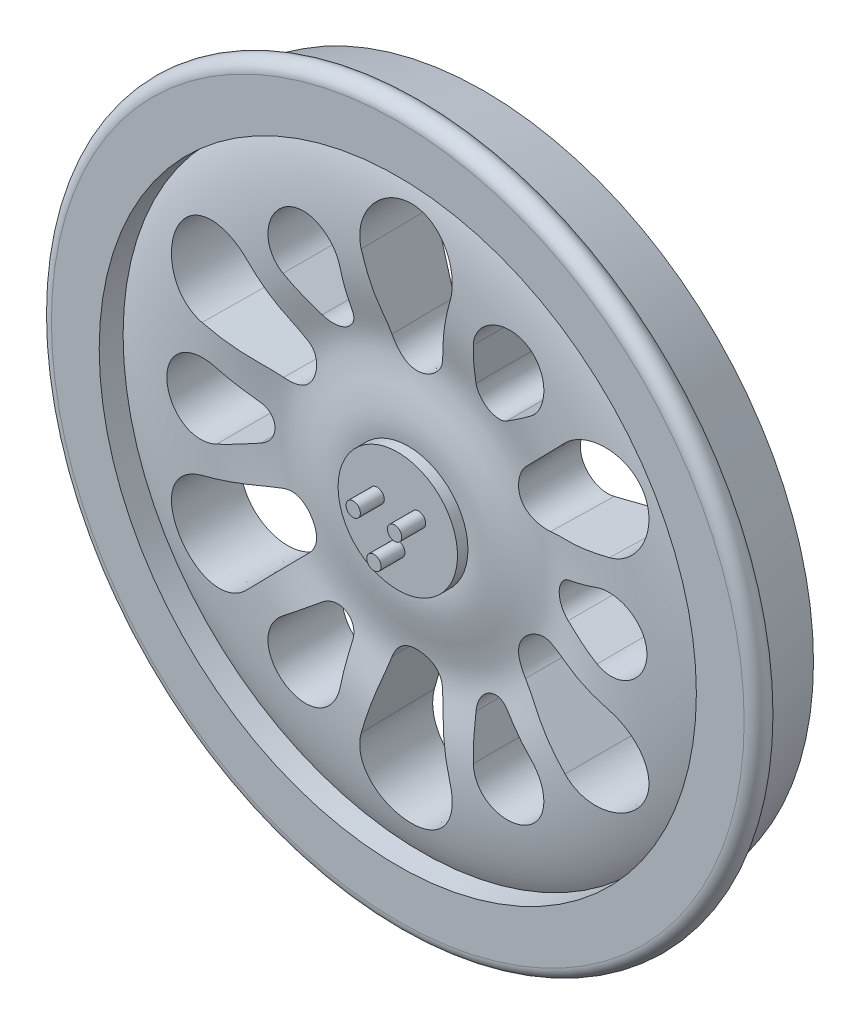
from build123d import *

# Parameters (mm, degrees)
SKETCH1_R                = 750
SKETCH1_R_2              = 625
BOSS_EXTRUDE1_DEPTH      = 50
FILLET1_R                = 25
SKETCH6_R                = 125
BOSS_EXTRUDE3_DEPTH      = 50
SKETCH8_R                = 15
BOSS_EXTRUDE4_DEPTH      = 50
CIRPATTERN1_COUNT        = 3
SKETCH9_W                = 12.905989232
SKETCH9_H                = 4
BOSS_EXTRUDE5_DEPTH      = 8
CIRPATTERN2_COUNT        = 9
SKETCH10_W               = 13.894129237
SKETCH10_H               = 6.210254734
BOSS_EXTRUDE6_DEPTH      = 10
CIRPATTERN3_COUNT        = 6
CUT_EXTRUDE1_DEPTH       = 203.423162
CUT_EXTRUDE1_DRAFT       = -1
CIRPATTERN4_COPY_1_DEPTH = 203.423162
CIRPATTERN4_COPY_1_DRAFT = -1
CIRPATTERN4_COPY_2_DEPTH = 203.423162
CIRPATTERN4_COPY_2_DRAFT = -1
CIRPATTERN4_COPY_3_DEPTH = 203.423162
CIRPATTERN4_COPY_3_DRAFT = -1
CIRPATTERN4_COPY_4_DEPTH = 203.423162
CIRPATTERN4_COPY_4_DRAFT = -1
CIRPATTERN4_COPY_5_DEPTH = 203.423162
CIRPATTERN4_COPY_5_DRAFT = -1
CUT_EXTRUDE2_REACH       = 1092.515
CIRPATTERN5_COUNT        = 6


with BuildPart() as part:
    # Sketch1 → Boss-Extrude1 (new body)
    with BuildSketch(Plane.XY):
        Circle(SKETCH1_R)
        Circle(SKETCH1_R_2, mode=Mode.SUBTRACT)
    extrude(amount=BOSS_EXTRUDE1_DEPTH)

    # Fillet1
    fillet1_edges = [part.edges().sort_by_distance(p)[0] for p in [
        (-750, 0, 0),
        (-750, 0, 50),
    ]]
    fillet(fillet1_edges, radius=FILLET1_R - 0.0001)  # a hair under: the kernel refuses the full size

    # Sketch4 → Revolve2 (revolve)
    with BuildSketch(Plane(origin=(0, 0, 0), x_dir=(0, 0, -1), z_dir=(1, 0, 0)), mode=Mode.PRIVATE) as revolve2_sk:
        Polygon((0, 0), (0, 725), (130, 690.166604984), (130, 645.166604984), (122, 645.166604984), (123.423161996, 125), (143.423161996, 125), (143.423161996, 0), align=None)
    revolve(revolve2_sk.sketch.rotate(Axis((0, 0, -143.423161996), (0, 0, 1)), 270), axis=Axis((0, 0, -143.423161996), (0, 0, 1)))

    # Sketch6 → Boss-Extrude3 (add)
    with BuildSketch(Plane.XY):
        with Locations(Location((0, 0, 0), (0, 0, 90))):
            Circle(SKETCH6_R)
    extrude(amount=BOSS_EXTRUDE3_DEPTH)

    # Sketch7 → Revolve3 (revolve)
    with BuildSketch(Plane(origin=(0, 0, 0), x_dir=(0, 0, -1), z_dir=(1, 0, 0))):
        with BuildLine():
            Line((-29.596042796, 0), (29.907052347, 0))
            Line((29.907052347, 0), (29.907052347, 625))
            Line((29.907052347, 625), (0, 625))
            add(Edge.make_bspline(
                [(0, 625), (-31.984047943, 561.665565463), (-43.874826253, 379.643970413), (10.233772598, 276.143642462), (-54.885565603, 132.651755512), (1.648232243, 44.929934245), (-29.596042796, 0)],
                knots=[0, 0, 0, 0, 0.281537496, 0.495292394, 0.717767116, 1, 1, 1, 1], degree=3))
        make_face()
    revolve(axis=Axis((0, 0, 29.596042796), (0, 0, -1)))

    # Sketch8 → Boss-Extrude4 (add)
    with BuildSketch(Plane.XY.offset(50)):
        with Locations((0, -50)):
            Circle(SKETCH8_R)
    boss_extrude4 = extrude(amount=BOSS_EXTRUDE4_DEPTH)

    # CirPattern1: Boss-Extrude4 ×3 about axis
    cirpattern1_axis = Axis((0, 0, 0), (0, 0, 1))
    for i in range(1, CIRPATTERN1_COUNT):
        add(boss_extrude4.rotate(cirpattern1_axis, i * 360 / CIRPATTERN1_COUNT))

    # Sketch9 → Boss-Extrude5 (add)
    with BuildSketch(Plane(origin=(0, 0, -143.423161996), x_dir=(-1, 0, 0), z_dir=(0, 0, -1))):
        Polygon((11.547005384, -103.966096475), (5.773502692, -93.966096475), (-5.773502692, -93.966096475), (-11.547005384, -103.966096475), (-5.773502692, -113.966096475), (5.773502692, -113.966096475), align=None)
        with Locations((0, -103.966096475)):
            Rectangle(SKETCH9_W, SKETCH9_H, mode=Mode.SUBTRACT)
    boss_extrude5 = extrude(amount=BOSS_EXTRUDE5_DEPTH)

    # CirPattern2: Boss-Extrude5 ×9 about axis
    cirpattern2_axis = Axis((0, 0, 0), (0, 0, 1))
    for i in range(1, CIRPATTERN2_COUNT):
        add(boss_extrude5.rotate(cirpattern2_axis, i * 360 / CIRPATTERN2_COUNT))

    # Sketch10 → Boss-Extrude6 (add)
    with BuildSketch(Plane(origin=(0, 0, -130), x_dir=(-1, 0, 0), z_dir=(0, 0, -1))):
        Polygon((11.547005384, -664.21212314), (5.773502692, -654.21212314), (-5.773502692, -654.21212314), (-11.547005384, -664.21212314), (-5.773502692, -674.21212314), (5.773502692, -674.21212314), align=None)
        with Locations((0.480168471, -664.46157868)):
            Rectangle(SKETCH10_W, SKETCH10_H, mode=Mode.SUBTRACT)
    boss_extrude6 = extrude(amount=BOSS_EXTRUDE6_DEPTH)

    # CirPattern3: Boss-Extrude6 ×6 about axis
    cirpattern3_axis = Axis((0, 0, 0), (0, 0, 1))
    for i in range(1, CIRPATTERN3_COUNT):
        add(boss_extrude6.rotate(cirpattern3_axis, i * 360 / CIRPATTERN3_COUNT))


with BuildPart() as cut_extrude1_tool:
    # Sketch11 → Cut-Extrude1 (with draft: the straight prism first)
    with BuildSketch(Plane(origin=(0, 0, -153.423161996), x_dir=(-1, 0, 0), z_dir=(0, 0, -1))):
        with BuildLine():
            ThreePointArc((-96.290481829, -437.773428551), (0, -564.757555535), (96.290481829, -437.773428551))
            Line((96.290481829, -437.773428551), (55.367027052, -291.741682519))
            ThreePointArc((55.367027052, -291.741682519), (0, -249.757555535), (-55.367027052, -291.741682519))
            Line((-55.367027052, -291.741682519), (-96.290481829, -437.773428551))
        make_face()
    extrude(amount=-CUT_EXTRUDE1_DEPTH)
    # Cut-Extrude1: the draft: its side faces are tilted about the plane it starts from
    cut_extrude1_sides = [cut_extrude1_tool.faces().sort_by_distance(p)[0] for p in [
        (-75.828754441, -364.757555535, -51.711580996),
        (0, -249.757555535, -51.711580996),
        (75.828754441, -364.757555535, -51.711580996),
        (0, -564.757555535, -51.711580996),
    ]]
    draft(cut_extrude1_sides, Plane(origin=(0, 0, -153.423161996), x_dir=(-1, 0, 0), z_dir=(0, 0, -1)), CUT_EXTRUDE1_DRAFT)


with BuildPart() as part_1:
    add(part.part)

    # Cut-Extrude1: cut by cut_extrude1_tool
    add(cut_extrude1_tool.part, mode=Mode.SUBTRACT)


with BuildPart() as cirpattern4_copy_1_tool:
    # CirPattern4 copy 1 sketch → CirPattern4 copy 1 (with draft: the straight prism first)
    with BuildSketch(Plane(origin=(0, 0, -153.423161996), x_dir=(-0.5000000000000001, -0.8660254037844386, 0), z_dir=(0, 0, -1))):
        with BuildLine():
            ThreePointArc((-96.290481829, -437.773428551), (0, -564.757555535), (96.290481829, -437.773428551))
            Line((96.290481829, -437.773428551), (55.367027052, -291.741682519))
            ThreePointArc((55.367027052, -291.741682519), (0, -249.757555535), (-55.367027052, -291.741682519))
            Line((-55.367027052, -291.741682519), (-96.290481829, -437.773428551))
        make_face()
    extrude(amount=-CIRPATTERN4_COPY_1_DEPTH)
    # CirPattern4 copy 1: the draft: its side faces are tilted about the plane it starts from
    cirpattern4_copy_1_sides = [cirpattern4_copy_1_tool.faces().sort_by_distance(p)[0] for p in [
        (277.974932095, -248.048405451, -51.711580996),
        (216.29638788, -124.878777767, -51.711580996),
        (353.803686536, -116.709150084, -51.711580996),
        (489.094390073, -282.378777767, -51.711580996),
    ]]
    draft(cirpattern4_copy_1_sides, Plane(origin=(0, 0, -153.423161996), x_dir=(-0.5000000000000001, -0.8660254037844386, 0), z_dir=(0, 0, -1)), CIRPATTERN4_COPY_1_DRAFT)


with BuildPart() as part_2:
    add(part_1.part)

    # CirPattern4 copy 1: cut by cirpattern4_copy_1_tool
    add(cirpattern4_copy_1_tool.part, mode=Mode.SUBTRACT)


with BuildPart() as cirpattern4_copy_2_tool:
    # CirPattern4 copy 2 sketch → CirPattern4 copy 2 (with draft: the straight prism first)
    with BuildSketch(Plane(origin=(0, 0, -153.423161996), x_dir=(0.4999999999999998, -0.8660254037844387, 0), z_dir=(0, 0, -1))):
        with BuildLine():
            ThreePointArc((-96.290481829, -437.773428551), (0, -564.757555535), (96.290481829, -437.773428551))
            Line((96.290481829, -437.773428551), (55.367027052, -291.741682519))
            ThreePointArc((55.367027052, -291.741682519), (0, -249.757555535), (-55.367027052, -291.741682519))
            Line((-55.367027052, -291.741682519), (-96.290481829, -437.773428551))
        make_face()
    extrude(amount=-CIRPATTERN4_COPY_2_DEPTH)
    # CirPattern4 copy 2: the draft: its side faces are tilted about the plane it starts from
    cirpattern4_copy_2_sides = [cirpattern4_copy_2_tool.faces().sort_by_distance(p)[0] for p in [
        (353.803686536, 116.709150084, -51.711580996),
        (216.29638788, 124.878777768, -51.711580996),
        (277.974932095, 248.048405451, -51.711580996),
        (489.094390073, 282.378777768, -51.711580996),
    ]]
    draft(cirpattern4_copy_2_sides, Plane(origin=(0, 0, -153.423161996), x_dir=(0.4999999999999998, -0.8660254037844387, 0), z_dir=(0, 0, -1)), CIRPATTERN4_COPY_2_DRAFT)


with BuildPart() as part_3:
    add(part_2.part)

    # CirPattern4 copy 2: cut by cirpattern4_copy_2_tool
    add(cirpattern4_copy_2_tool.part, mode=Mode.SUBTRACT)


with BuildPart() as cirpattern4_copy_3_tool:
    # CirPattern4 copy 3 sketch → CirPattern4 copy 3 (with draft: the straight prism first)
    with BuildSketch(Plane(origin=(0, 0, -153.423161996), x_dir=(1, 0, 0), z_dir=(0, 0, -1))):
        with BuildLine():
            ThreePointArc((-96.290481829, -437.773428551), (0, -564.757555535), (96.290481829, -437.773428551))
            Line((96.290481829, -437.773428551), (55.367027052, -291.741682519))
            ThreePointArc((55.367027052, -291.741682519), (0, -249.757555535), (-55.367027052, -291.741682519))
            Line((-55.367027052, -291.741682519), (-96.290481829, -437.773428551))
        make_face()
    extrude(amount=-CIRPATTERN4_COPY_3_DEPTH)
    # CirPattern4 copy 3: the draft: its side faces are tilted about the plane it starts from
    cirpattern4_copy_3_sides = [cirpattern4_copy_3_tool.faces().sort_by_distance(p)[0] for p in [
        (75.828754441, 364.757555535, -51.711580996),
        (0, 249.757555535, -51.711580996),
        (-75.828754441, 364.757555535, -51.711580996),
        (0, 564.757555535, -51.711580996),
    ]]
    draft(cirpattern4_copy_3_sides, Plane(origin=(0, 0, -153.423161996), x_dir=(1, 0, 0), z_dir=(0, 0, -1)), CIRPATTERN4_COPY_3_DRAFT)


with BuildPart() as part_4:
    add(part_3.part)

    # CirPattern4 copy 3: cut by cirpattern4_copy_3_tool
    add(cirpattern4_copy_3_tool.part, mode=Mode.SUBTRACT)


with BuildPart() as cirpattern4_copy_4_tool:
    # CirPattern4 copy 4 sketch → CirPattern4 copy 4 (with draft: the straight prism first)
    with BuildSketch(Plane(origin=(0, 0, -153.423161996), x_dir=(0.5000000000000004, 0.8660254037844384, 0), z_dir=(0, 0, -1))):
        with BuildLine():
            ThreePointArc((-96.290481829, -437.773428551), (0, -564.757555535), (96.290481829, -437.773428551))
            Line((96.290481829, -437.773428551), (55.367027052, -291.741682519))
            ThreePointArc((55.367027052, -291.741682519), (0, -249.757555535), (-55.367027052, -291.741682519))
            Line((-55.367027052, -291.741682519), (-96.290481829, -437.773428551))
        make_face()
    extrude(amount=-CIRPATTERN4_COPY_4_DEPTH)
    # CirPattern4 copy 4: the draft: its side faces are tilted about the plane it starts from
    cirpattern4_copy_4_sides = [cirpattern4_copy_4_tool.faces().sort_by_distance(p)[0] for p in [
        (-277.974932095, 248.048405451, -51.711580996),
        (-216.29638788, 124.878777767, -51.711580996),
        (-353.803686536, 116.709150084, -51.711580996),
        (-489.094390073, 282.378777768, -51.711580996),
    ]]
    draft(cirpattern4_copy_4_sides, Plane(origin=(0, 0, -153.423161996), x_dir=(0.5000000000000004, 0.8660254037844384, 0), z_dir=(0, 0, -1)), CIRPATTERN4_COPY_4_DRAFT)


with BuildPart() as part_5:
    add(part_4.part)

    # CirPattern4 copy 4: cut by cirpattern4_copy_4_tool
    add(cirpattern4_copy_4_tool.part, mode=Mode.SUBTRACT)


with BuildPart() as cirpattern4_copy_5_tool:
    # CirPattern4 copy 5 sketch → CirPattern4 copy 5 (with draft: the straight prism first)
    with BuildSketch(Plane(origin=(0, 0, -153.423161996), x_dir=(-0.5000000000000001, 0.8660254037844386, 0), z_dir=(0, 0, -1))):
        with BuildLine():
            ThreePointArc((-96.290481829, -437.773428551), (0, -564.757555535), (96.290481829, -437.773428551))
            Line((96.290481829, -437.773428551), (55.367027052, -291.741682519))
            ThreePointArc((55.367027052, -291.741682519), (0, -249.757555535), (-55.367027052, -291.741682519))
            Line((-55.367027052, -291.741682519), (-96.290481829, -437.773428551))
        make_face()
    extrude(amount=-CIRPATTERN4_COPY_5_DEPTH)
    # CirPattern4 copy 5: the draft: its side faces are tilted about the plane it starts from
    cirpattern4_copy_5_sides = [cirpattern4_copy_5_tool.faces().sort_by_distance(p)[0] for p in [
        (-353.803686536, -116.709150084, -51.711580996),
        (-216.29638788, -124.878777768, -51.711580996),
        (-277.974932095, -248.048405451, -51.711580996),
        (-489.094390073, -282.378777768, -51.711580996),
    ]]
    draft(cirpattern4_copy_5_sides, Plane(origin=(0, 0, -153.423161996), x_dir=(-0.5000000000000001, 0.8660254037844386, 0), z_dir=(0, 0, -1)), CIRPATTERN4_COPY_5_DRAFT)


with BuildPart() as part_6:
    add(part_5.part)

    # CirPattern4 copy 5: cut by cirpattern4_copy_5_tool
    add(cirpattern4_copy_5_tool.part, mode=Mode.SUBTRACT)

    # Sketch12 → Cut-Extrude2 (cut, up to next)
    with BuildSketch(Plane(origin=(0, 0, -153.423161996), x_dir=(-1, 0, 0), z_dir=(0, 0, -1)), mode=Mode.PRIVATE) as cut_extrude2_sk1:
        with BuildLine():
            Line((-258.968514004, -310.353924217), (-192.84911225, -260.321687493))
            ThreePointArc((-192.84911225, -260.321687493), (-148.712653103, -257.577870902), (-129.0206384, -297.173074052))
            Line((-129.0206384, -297.173074052), (-139.290125534, -379.450274016))
            ThreePointArc((-139.290125534, -379.450274016), (-251.212653103, -435.113078678), (-258.968514004, -310.353924217))
        make_face()
    cut_extrude2_tool1 = extrude(cut_extrude2_sk1.sketch, amount=-CUT_EXTRUDE2_REACH, mode=Mode.PRIVATE) & part_6.part
    cut_extrude2 = cut_extrude2_tool1.solids().sort_by_distance((203.835058, -353.052676, -153.423162))[0]
    add(cut_extrude2, mode=Mode.SUBTRACT)

    # CirPattern5: Cut-Extrude2 ×6 about axis
    cirpattern5_axis = Axis((0, 0, 0), (0, 0, 1))
    for i in range(1, CIRPATTERN5_COUNT):
        add(cut_extrude2.rotate(cirpattern5_axis, i * 360 / CIRPATTERN5_COUNT), mode=Mode.SUBTRACT)


solid = part_6.part
